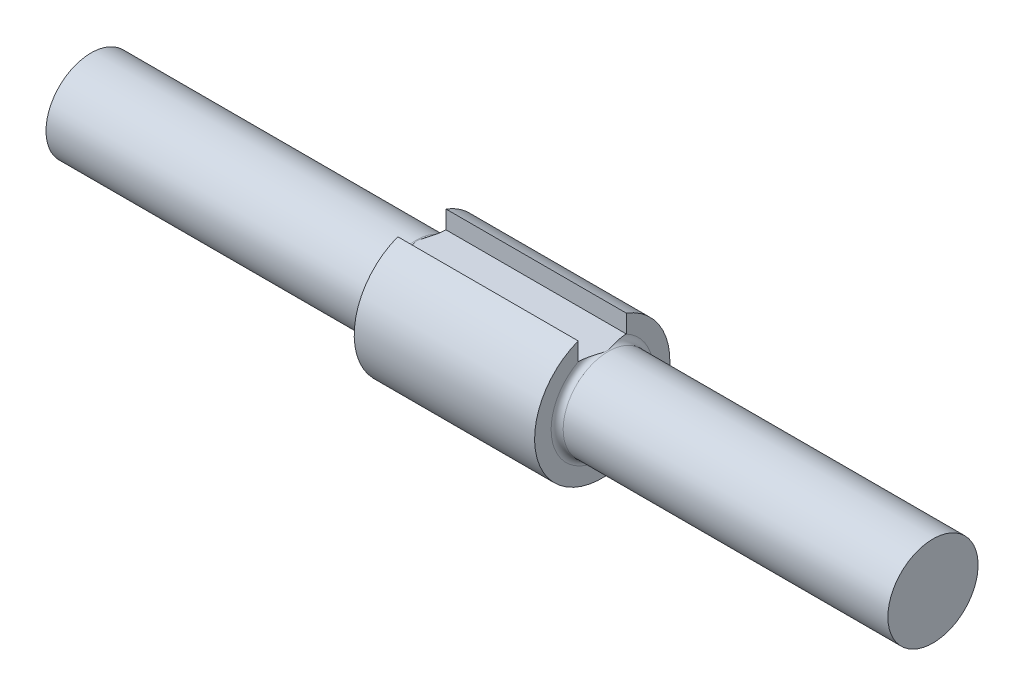
from build123d import *

# Parameters (mm, degrees)
CUT_EXTRUDE1_DEPTH      = 72.785270077
CUT_EXTRUDE1_DEPTH_BACK = 72.785270077
SKETCH4_W               = 4
SKETCH4_H               = 3
FILLET5_R               = 1
FILLET6_R               = 1


with BuildPart() as part:
    # Sketch1 → Revolve1 (revolve)
    with BuildSketch(Plane.XY, mode=Mode.PRIVATE) as revolve1_sk:
        Polygon((0, 0), (70, 0), (70, 7.5), (15, 7.5), (15, 11.25), (-15, 11.25), (-15, 7.5), (-70, 7.5), (-70, 0), align=None)
    revolve(revolve1_sk.sketch.rotate(Axis((0, 0, 0), (1, 0, 0)), 90), axis=Axis((0, 0, 0), (1, 0, 0)))

    # Sketch4 → Cut-Extrude1 (cut, two sides: drawn at the far end of the back side and taken through both)
    with BuildSketch(Plane(origin=(0, 0, 0), x_dir=(0, 0, -1), z_dir=(1, 0, 0)).offset(-CUT_EXTRUDE1_DEPTH_BACK)):
        with Locations((2, 9.014870422)):
            Rectangle(SKETCH4_W, SKETCH4_H)
        with Locations((-2, 9.014870422)):
            Rectangle(SKETCH4_W, SKETCH4_H)
        with BuildLine():
            Line((0, 11.25), (0, 10.514870422))
            Line((0, 10.514870422), (4, 10.514870422))
            ThreePointArc((4, 10.514870422), (2.033495482, 11.064691416), (0, 11.25))
        make_face()
        with BuildLine():
            Line((-4, 10.514870422), (0, 10.514870422))
            Line((0, 10.514870422), (0, 11.25))
            ThreePointArc((0, 11.25), (-2.033495482, 11.064691416), (-4, 10.514870422))
        make_face()
    extrude(amount=CUT_EXTRUDE1_DEPTH + CUT_EXTRUDE1_DEPTH_BACK, mode=Mode.SUBTRACT)

    # Fillet5
    # the kernel refuses this fillet: 1 mm, written as the material it adds along each edge
    with BuildSketch(Plane(origin=(-15, 0, 0), x_dir=(0, 0, 1), z_dir=(0, 1, 0))) as fillet5_piece_1_section:
        with BuildLine():
            CenterArc((7.5 + FILLET5_R, -FILLET5_R), FILLET5_R, 90, 90)
            Line((7.5, -FILLET5_R), (7.5, 0))
            Line((7.5, 0), (7.5 + FILLET5_R, 0))
        make_face()
    fillet5_piece_1 = revolve(axis=Axis((-15, 0, 0), (1, 0, 0)), mode=Mode.PRIVATE)
    fillet5_piece_1 = split(fillet5_piece_1, bisect_by=Plane(origin=(-15.276890307, 7.514870422, -7.776890307), z_dir=(0, -1, 0)), keep=Keep.TOP, mode=Mode.PRIVATE)
    add(fillet5_piece_1)

    # Fillet6
    # the kernel refuses this fillet: 1 mm, written as the material it adds along each edge
    with BuildSketch(Plane(origin=(15, 0, 0), x_dir=(0, 0, 1), z_dir=(0, 1, 0))) as fillet6_piece_1_section:
        with BuildLine():
            CenterArc((7.5 + FILLET6_R, FILLET6_R), FILLET6_R, 180, 90)
            Line((7.5, FILLET6_R), (7.5, 0))
            Line((7.5, 0), (7.5 + FILLET6_R, 0))
        make_face()
    fillet6_piece_1 = revolve(axis=Axis((15, 0, 0), (1, 0, 0)), mode=Mode.PRIVATE)
    fillet6_piece_1 = split(fillet6_piece_1, bisect_by=Plane(origin=(15.276890307, 7.514870422, -7.776890307), z_dir=(0, -1, 0)), keep=Keep.TOP, mode=Mode.PRIVATE)
    add(fillet6_piece_1)


solid = part.part
